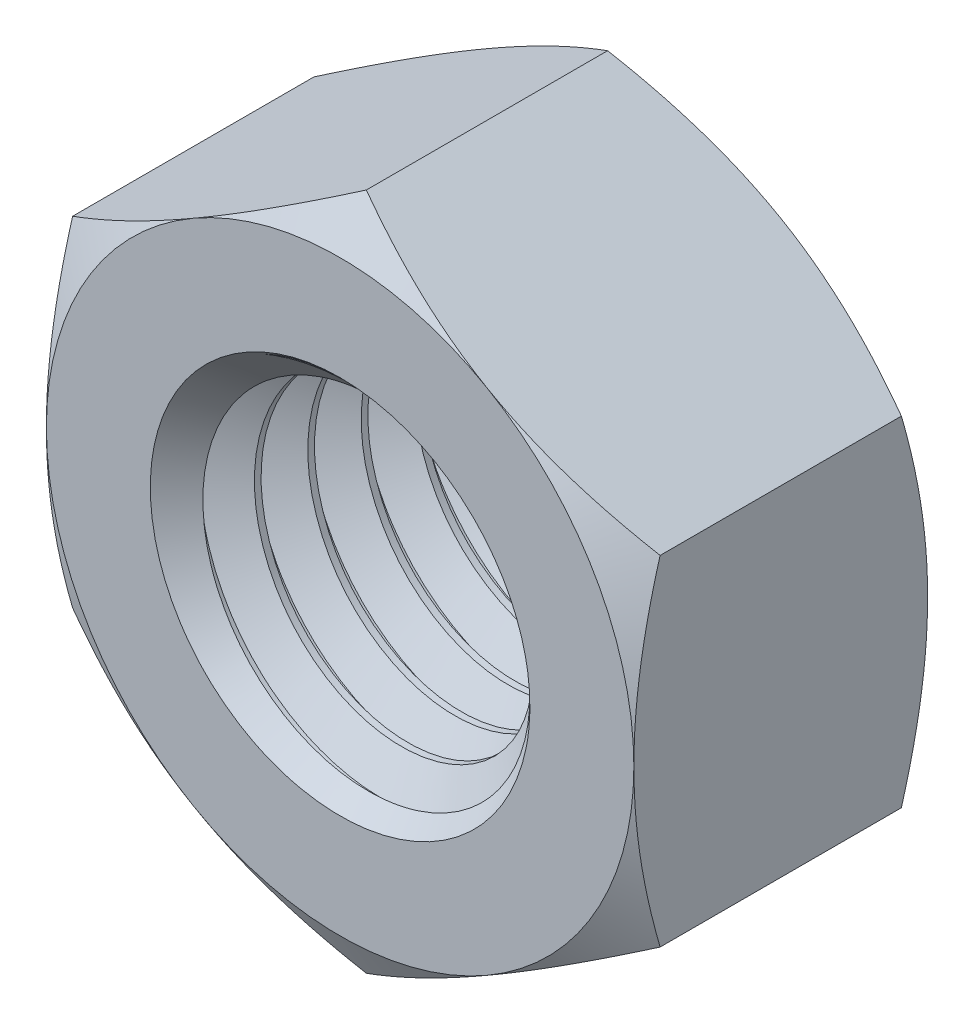
from build123d import *

# Parameters (mm, degrees)
BOSS_EXTRUDE1_DEPTH      = 5.5
BOSS_EXTRUDE1_DEPTH_BACK = 5.5
SKETCH2_R                = 7
SKETCH3_OUTSIDE_W        = 104.106
SKETCH3_OUTSIDE_H        = 107.51
SKETCH3_OUTSIDE_R        = 11
CUT_EXTRUDE1_DEPTH       = 21.083160442
CUT_EXTRUDE1_DRAFT       = -60
MIRROR1_COPY_1_SKETCH_W  = 104.106
MIRROR1_COPY_1_SKETCH_H  = 107.51
MIRROR1_COPY_1_SKETCH_R  = 11
MIRROR1_COPY_1_DEPTH     = 21.083160442
MIRROR1_COPY_1_DRAFT     = -60
SWEEP1_PITCH             = 2
SKETCH6_R                = 7.108253175
CUT_EXTRUDE2_DEPTH       = 22.282909679
SKETCH7_R                = 7.108253175
CUT_EXTRUDE3_DEPTH       = 21.083160551


with BuildPart() as part:
    # Sketch2 → Boss-Extrude1 (new, two sides: drawn at the far end of the back side and taken through both)
    with BuildSketch(Plane.XY.offset(-BOSS_EXTRUDE1_DEPTH_BACK)):
        Polygon((0, 12.701705922), (-11, 6.350852961), (-11, -6.350852961), (0, -12.701705922), (11, -6.350852961), (11, 6.350852961), align=None)
        Circle(SKETCH2_R, mode=Mode.SUBTRACT)
    extrude(amount=BOSS_EXTRUDE1_DEPTH + BOSS_EXTRUDE1_DEPTH_BACK)


with BuildPart() as cut_extrude1_tool:
    # Sketch3 outside → Cut-Extrude1 (with draft: the straight prism first)
    with BuildSketch(Plane.XY.offset(5.5)):
        Rectangle(SKETCH3_OUTSIDE_W, SKETCH3_OUTSIDE_H)
        Circle(SKETCH3_OUTSIDE_R, mode=Mode.SUBTRACT)
    extrude(amount=-CUT_EXTRUDE1_DEPTH)
    # Cut-Extrude1: the draft: its side faces are tilted about the plane it starts from
    cut_extrude1_sides = [cut_extrude1_tool.faces().sort_by_distance(p)[0] for p in [
        (0, -53.755, -5.041580221),
        (52.053, 0, -5.041580221),
        (0, 53.755, -5.041580221),
        (-52.053, 0, -5.041580221),
        (-11, 0, -5.041580221),
    ]]
    draft(cut_extrude1_sides, Plane.XY.offset(5.5), CUT_EXTRUDE1_DRAFT)


with BuildPart() as part_1:
    add(part.part)

    # Cut-Extrude1: cut by cut_extrude1_tool
    add(cut_extrude1_tool.part, mode=Mode.SUBTRACT)


with BuildPart() as mirror1_copy_1_tool:
    # Mirror1 copy 1 sketch → Mirror1 copy 1 (with draft: the straight prism first)
    with BuildSketch(Plane(origin=(0, 0, -5.5), x_dir=(1, 0, 0), z_dir=(0, 0, -1))):
        Rectangle(MIRROR1_COPY_1_SKETCH_W, MIRROR1_COPY_1_SKETCH_H)
        Circle(MIRROR1_COPY_1_SKETCH_R, mode=Mode.SUBTRACT)
    extrude(amount=-MIRROR1_COPY_1_DEPTH)
    # Mirror1 copy 1: the draft: its side faces are tilted about the plane it starts from
    mirror1_copy_1_sides = [mirror1_copy_1_tool.faces().sort_by_distance(p)[0] for p in [
        (0, -53.755, 5.041580221),
        (52.053, 0, 5.041580221),
        (0, 53.755, 5.041580221),
        (-52.053, 0, 5.041580221),
        (-11, 0, 5.041580221),
    ]]
    draft(mirror1_copy_1_sides, Plane(origin=(0, 0, -5.5), x_dir=(1, 0, 0), z_dir=(0, 0, -1)), MIRROR1_COPY_1_DRAFT)


with BuildPart() as part_2:
    add(part_1.part)

    # Mirror1 copy 1: cut by mirror1_copy_1_tool
    add(mirror1_copy_1_tool.part, mode=Mode.SUBTRACT)

    # Sweep1: the profile of Sketch4 screwed along a right-hand helix of 6.5 turns, 10 arcs to a turn; built about Z, then put on its axis
    sweep1_z = Axis((0, 0, 0), (0, 0, 1))
    sweep1_corners = [(7.108253175, 0, -1.8125), (5.700961894, 0, -1), (5.700961894, 0, -0.75), (7.108253175, 0, 0.0625)]
    with BuildLine(mode=Mode.PRIVATE) as sweep1_profile:
        Line(sweep1_corners[0], sweep1_corners[1])
        Line(sweep1_corners[1], sweep1_corners[2])
        Line(sweep1_corners[2], sweep1_corners[3])
        Line(sweep1_corners[3], sweep1_corners[0])
    sweep1_cap = Face(sweep1_profile.wire())
    sweep1_turn_angles = [0, 18, 36, 54, 72, 90, 108, 126, 144, 162, 180, 198, 216, 234, 252, 270, 288, 306, 324, 342, 360]
    sweep1_turn_weights = [1, 0.9510565162951535, 1, 0.9510565162951535, 1, 0.9510565162951535, 1, 0.9510565162951535, 1, 0.9510565162951535, 1, 0.9510565162951535, 1, 0.9510565162951535, 1, 0.9510565162951535, 1, 0.9510565162951535, 1, 0.9510565162951535, 1]
    sweep1_turn_rails = [Edge.make_bspline([Vector(p[0], p[1], 0).rotate(sweep1_z, sweep1_turn_angles[k]) / sweep1_turn_weights[k] + Vector(0, 0, p[2] + SWEEP1_PITCH * sweep1_turn_angles[k] / 360) for k in range(21)], [0, 0, 0, 1, 1, 2, 2, 3, 3, 4, 4, 5, 5, 6, 6, 7, 7, 8, 8, 9, 9, 10, 10, 10], 2, sweep1_turn_weights) for p in sweep1_corners]
    sweep1_turn_sides = [Face.make_surface_from_curves(sweep1_turn_rails[p[0]], sweep1_turn_rails[p[1]]) for p in [(0, 1), (1, 2), (2, 3), (3, 0)]]
    sweep1_last_angles = [2160, 2178, 2196, 2214, 2232, 2250, 2268, 2286, 2304, 2322, 2340]
    sweep1_last_weights = [1, 0.9510565162951535, 1, 0.9510565162951535, 1, 0.9510565162951535, 1, 0.9510565162951535, 1, 0.951056516295134, 1]
    sweep1_last_rails = [Edge.make_bspline([Vector(p[0], p[1], 0).rotate(sweep1_z, sweep1_last_angles[k]) / sweep1_last_weights[k] + Vector(0, 0, p[2] + SWEEP1_PITCH * sweep1_last_angles[k] / 360) for k in range(11)], [0, 0, 0, 1, 1, 2, 2, 3, 3, 4, 4, 5, 5, 5], 2, sweep1_last_weights) for p in sweep1_corners]
    sweep1_last_sides = [Face.make_surface_from_curves(sweep1_last_rails[p[0]], sweep1_last_rails[p[1]]) for p in [(0, 1), (1, 2), (2, 3), (3, 0)]]
    sweep1 = Plane(origin=(0, 0, 5.5), x_dir=(0, 1, 0), z_dir=(0, 0, -1)) * Solid(Shell([*[p.moved(Location((0, 0, SWEEP1_PITCH * i))) for i in range(6) for p in sweep1_turn_sides], *sweep1_last_sides, sweep1_cap, sweep1_cap.rotate(sweep1_z, 2340).moved(Location((0, 0, SWEEP1_PITCH * 2340 / 360)))]))
    add(sweep1)

    # Sketch6 → Cut-Extrude2 (cut)
    with BuildSketch(Plane.XY.offset(5.5)):
        Circle(SKETCH6_R)
    extrude(amount=CUT_EXTRUDE2_DEPTH, mode=Mode.SUBTRACT)

    # Cut-Extrude2 cone 1 section (through the dimple's axis) → Cut-Extrude2 other way (revolve, cut)
    with BuildSketch(Plane(origin=(0, 0, 5.5), x_dir=(0, -1, 0), z_dir=(1, 0, 0))):
        Polygon((0, 0), (7.108253175, 0), (0, 7.108253175), align=None)
    revolve(axis=Axis((0, 0, 5.5), (0, 0, -1)), mode=Mode.SUBTRACT)

    # Sketch7 → Cut-Extrude3 (cut)
    with BuildSketch(Plane(origin=(0, 0, -5.5), x_dir=(-1, 0, 0), z_dir=(0, 0, -1))):
        Circle(SKETCH7_R)
    extrude(amount=CUT_EXTRUDE3_DEPTH, mode=Mode.SUBTRACT)

    # Cut-Extrude3 cone 1 section (through the dimple's axis) → Cut-Extrude3 other way (revolve, cut)
    with BuildSketch(Plane(origin=(0, 0, -5.5), x_dir=(0, 1, 0), z_dir=(1, 0, 0))):
        Polygon((0, 0), (7.108253175, 0), (0, 7.108253175), align=None)
    revolve(axis=Axis((0, 0, -5.5), (0, 0, 1)), mode=Mode.SUBTRACT)


solid = part_2.part
